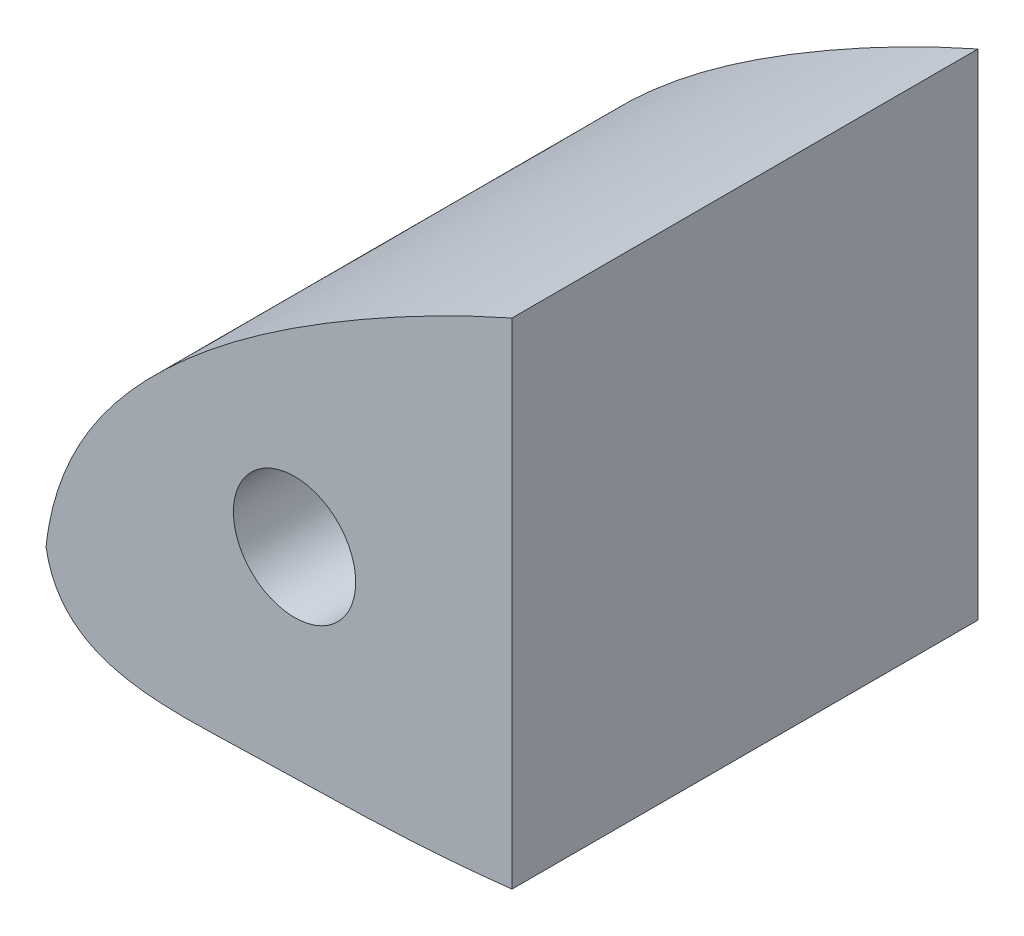
from build123d import *

# Parameters (mm, degrees)
BOSS_EXTRUDE1_DEPTH = 38.1
SKETCH2_R           = 5
SKETCH2_R_2         = 3.175
CUT_EXTRUDE1_DEPTH  = 319.018514003
SKETCH3_W           = 293.188888759
SKETCH3_H           = 137.971241769
CUT_EXTRUDE2_DEPTH  = 319.018514003
SKETCH4_R           = 7
CUT_EXTRUDE3_DEPTH  = 3.175


with BuildPart() as part:
    # Sketch1 → Boss-Extrude1 (new body)
    with BuildSketch(Plane.XY):
        with BuildLine():
            add(Edge.make_bspline(
                [(0.000560351, 0.000130087), (0.810633127, 7.359196055), (8.649092025, 17.856605174), (26.286719818, 29.975176328), (52.111128271, 42.069215275), (89.597618475, 49.290763054), (131.400792109, 47.884831915), (173.256699242, 40.041104278), (217.961060472, 29.612974894), (256.952064401, 19.528920948), (290.35983767, 8.71099439), (301.273197721, 4.382828139), (314.816918223, -0.516206742), (309.846313895, 0.000130087)],
                knots=[0, 0, 0, 0, 0.060863618, 0.113688265, 0.188608742, 0.312908923, 0.448482434, 0.557612135, 0.691544113, 0.852438279, 0.92975597, 0.976058229, 1, 1, 1, 1], degree=3))
            add(Edge.make_bspline(
                [(309.846313895, 0.000130087), (303.956832565, 1.47095521), (293.989507544, 2.093987313), (276.26402299, 4.514356704), (260.846344817, 5.427413394), (235.858814759, 7.870306192), (205.101424636, 8.838080282), (157.718638092, 9.030650149), (110.497331172, 6.181495223), (66.506197185, -0.586669107), (36.454672816, -6.098499901), (15.316603331, -6.189065841), (1.230714189, -6.924076091), (0.000560351, 0.000130087)],
                knots=[0, 0, 0, 0, 0.057787081, 0.095274891, 0.171021118, 0.205339302, 0.335319146, 0.464904334, 0.658702312, 0.785511947, 0.893517288, 0.94309214, 1, 1, 1, 1], degree=3))
        make_face()
    extrude(amount=BOSS_EXTRUDE1_DEPTH)

    # Sketch2 → Cut-Extrude1 (cut, through all)
    with BuildSketch(Plane.XY.offset(38.1)):
        with Locations((20.32, 10.16)):
            Circle(SKETCH2_R)
        with Locations((227.296313895, 19.050130087)):
            Circle(SKETCH2_R_2)
    extrude(amount=-CUT_EXTRUDE1_DEPTH, mode=Mode.SUBTRACT)

    # Sketch3 → Cut-Extrude2 (cut, through all)
    with BuildSketch(Plane.XY.offset(38.1)):
        with Locations((184.69444438, 2.732377951)):
            Rectangle(SKETCH3_W, SKETCH3_H)
    extrude(amount=-CUT_EXTRUDE2_DEPTH, mode=Mode.SUBTRACT)

    # Sketch4 → Cut-Extrude3 (cut)
    with BuildSketch(Plane(origin=(0, 0, 0), x_dir=(-1, 0, 0), z_dir=(0, 0, -1))):
        with Locations((-20.32, 10.16)):
            Circle(SKETCH4_R)
    extrude(amount=-CUT_EXTRUDE3_DEPTH, mode=Mode.SUBTRACT)


solid = part.part
